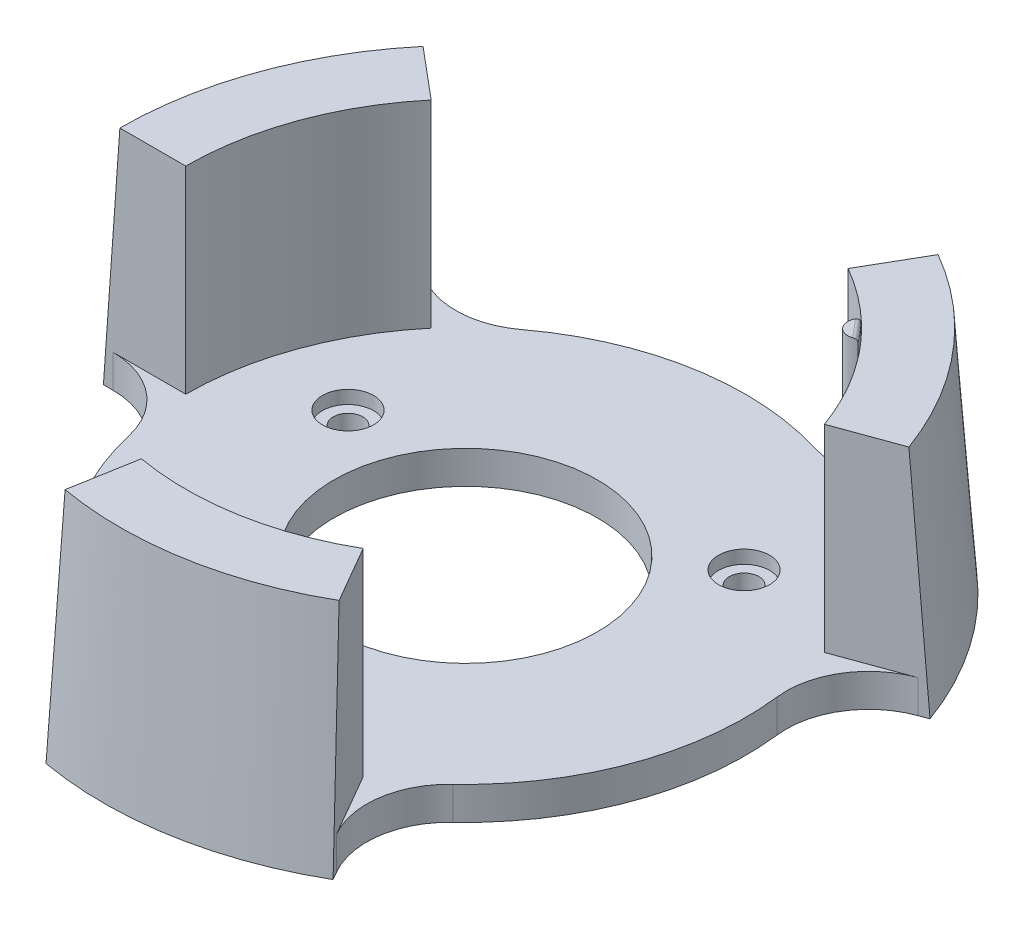
from build123d import *

# Parameters (mm, degrees)
SKETCH1_R           = 17
SKETCH1_R_2         = 8
BOSS_EXTRUDE4_DEPTH = 2
REVOLVE2_ANGLE      = 40
CIRPATTERN1_COUNT   = 3
FILLET1_R           = 5
BOSS_EXTRUDE6_DEPTH = 13
FILLET2_R           = 0.25
SKETCH25_R          = 0.9
CUT_EXTRUDE1_DEPTH  = 34.719430639
SKETCH26_R          = 1.55
CUT_EXTRUDE2_DEPTH  = 0.8


with BuildPart() as part:
    # Sketch1 → Boss-Extrude4 (new body)
    with BuildSketch(Plane(origin=(0, 0, 0), x_dir=(1, 0, 0), z_dir=(0, 1, 0))):
        with Locations(Location((0, 0, 0), (0, 0, 270))):
            Circle(SKETCH1_R)
        with Locations(Location((0, 0, 0), (0, 0, 270))):
            Circle(SKETCH1_R_2, mode=Mode.SUBTRACT)
    extrude(amount=BOSS_EXTRUDE4_DEPTH)

    # Sketch5 → Revolve2 (revolve)
    with BuildSketch(Plane.XY):
        Polygon((-17, 0), (-22, 0), (-21, 14), (-17, 14), align=None)
    revolve2 = revolve(axis=Axis((0, 9.813682869, 0), (0, -1, 0)), revolution_arc=REVOLVE2_ANGLE)

    # CirPattern1: Revolve2 ×3 about axis
    cirpattern1_axis = Axis((0, 0, 0), (0, 1, 0))
    for i in range(1, CIRPATTERN1_COUNT):
        add(revolve2.rotate(cirpattern1_axis, i * 360 / CIRPATTERN1_COUNT))

    # Fillet1
    fillet1_edges = [part.edges().sort_by_distance(p)[0] for p in [
        (-13.022755533, 1, -10.927389365),
        (-17, 1, 0),
        (-2.95201902, 1, 16.741731801),
        (8.5, 1, 14.722431864),
        (15.974774553, 1, -5.814342437),
        (8.5, 1, -14.722431864),
    ]]
    fillet(fillet1_edges, radius=FILLET1_R)

    # Sketch24 → Boss-Extrude6 (add)
    with BuildSketch(Plane(origin=(0, 2, 0), x_dir=(1, 0, 0), z_dir=(0, 1, 0))):
        with BuildLine():
            ThreePointArc((12.528097784, 11.491160338), (12.448209945, 10.445288373), (13.492065142, 10.342348776))
            ThreePointArc((13.492065142, 10.342348776), (13.022755533, 10.927389365), (12.528097784, 11.491160338))
        make_face()
    extrude(amount=BOSS_EXTRUDE6_DEPTH)

    # Fillet2
    # the kernel refuses this fillet: 0.25 mm, written as the material it takes off along each edge
    with BuildSketch(Plane(origin=(0, 15, 0), x_dir=(0.8154762444384231, 0, -0.578790544805809), z_dir=(0.578790544805809, 0, 0.8154762444384231))) as fillet2_piece_1:
        with BuildLine():
            CenterArc((17 - FILLET2_R, -FILLET2_R), FILLET2_R, 0, 90)
            Line((17 - FILLET2_R, 0), (17, 0))
            Line((17, 0), (17, -FILLET2_R))
        make_face()
    revolve(axis=Axis((0, 15, 0), (0, 1, 0)), revolution_arc=9.268958216, mode=Mode.SUBTRACT)

    # Sketch25 → Cut-Extrude1 (cut, through all)
    with BuildSketch(Plane(origin=(0, 2, 0), x_dir=(1, 0, 0), z_dir=(0, 1, 0))):
        with Locations(Location((2.083778132, -11.817693036, 0), (0, 0, 270))):
            Circle(SKETCH25_R)
        with Locations(Location((-11.236091343, 4.089602798, 0), (0, 0, 270))):
            Circle(SKETCH25_R)
        with Locations(Location((9.192533317, 7.713451316, 0), (0, 0, 270))):
            Circle(SKETCH25_R)
    extrude(amount=-CUT_EXTRUDE1_DEPTH, mode=Mode.SUBTRACT)

    # Sketch26 → Cut-Extrude2 (cut)
    with BuildSketch(Plane(origin=(0, 2, 0), x_dir=(1, 0, 0), z_dir=(0, 1, 0))):
        with Locations(Location((2.083778132, -11.817693036, 0), (0, 0, 270))):
            Circle(SKETCH26_R)
        with Locations(Location((-11.236091343, 4.089602798, 0), (0, 0, 270))):
            Circle(SKETCH26_R)
        with Locations(Location((9.192533317, 7.713451316, 0), (0, 0, 270))):
            Circle(SKETCH26_R)
    extrude(amount=-CUT_EXTRUDE2_DEPTH, mode=Mode.SUBTRACT)


solid = part.part
